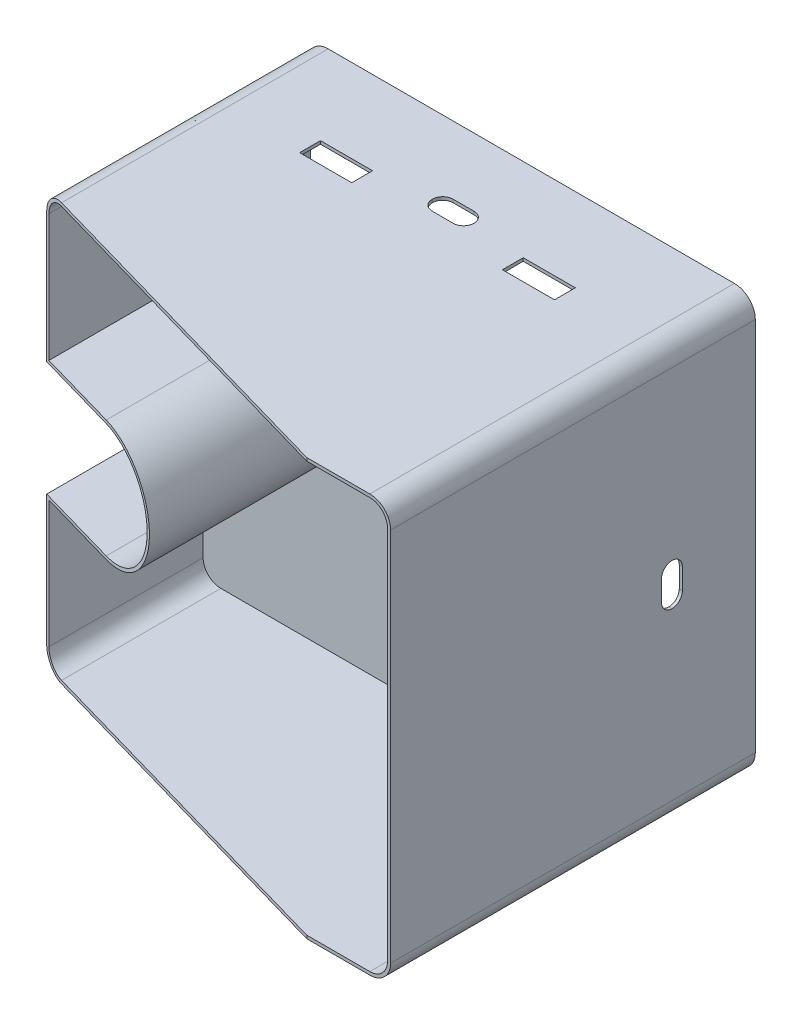
from build123d import *

# Parameters (mm, degrees)
EXTRUDE_1_DEPTH     = 250
SHELL_1_T           = -3
CUT_EXTRUDE_1_DEPTH = 547
EXTRUDE_START       = 100
EXTRUDE_3_DEPTH     = 100
SKETCH_6_W          = 50
SKETCH_6_H          = 20
CUT_EXTRUDE_3_DEPTH = 472
SKETCH_7_W          = 20
SKETCH_7_H          = 40
CUT_EXTRUDE_4_DEPTH = 472
FILLET_1_R          = 10
FILLET_2_R          = 10
CUT_EXTRUDE_5_DEPTH = 472


with BuildPart() as part:
    # 草图1 → 凸台-拉伸1 (new body)
    with BuildSketch(Plane.XY):
        with BuildLine():
            Line((-135, 55), (-215, 55))
            Line((-215, 55), (-215, 180))
            ThreePointArc((-215, 180), (-209.142135624, 194.142135624), (-195, 200))
            Line((-195, 200), (195, 200))
            ThreePointArc((195, 200), (209.142135624, 194.142135624), (215, 180))
            Line((215, 180), (215, -180))
            ThreePointArc((215, -180), (209.142135624, -194.142135624), (195, -200))
            Line((195, -200), (-195, -200))
            ThreePointArc((-195, -200), (-209.142135624, -194.142135624), (-215, -180))
            Line((-215, -180), (-215, -55))
            Line((-215, -55), (-135, -55))
            ThreePointArc((-135, -55), (-80, 0), (-135, 55))
        make_face()
    extrude(amount=EXTRUDE_1_DEPTH)

    # 抽壳1
    shell_1_openings = [part.faces().sort_by_distance(p)[0] for p in [
        (13.096091643, 0, 250),
    ]]
    offset(amount=SHELL_1_T, openings=shell_1_openings, kind=Kind.INTERSECTION)

    # 草图3 → 切除-拉伸1 (cut)
    with BuildSketch(Plane(origin=(0, 200, 0), x_dir=(1, 0, 0), z_dir=(0, 1, 0))):
        Polygon((134.47381547, -250), (-215.52618453, -150), (-215.52618453, -250), align=None)
    extrude(amount=-CUT_EXTRUDE_1_DEPTH, mode=Mode.SUBTRACT)

    # 草图4 → 凸台-拉伸3 (add)
    with BuildSketch(Plane(origin=(0, 0, 0), x_dir=(-1, 0, 0), z_dir=(0, 0, -1)).offset(EXTRUDE_START)):
        with BuildLine():
            Line((195, -200), (-195, -200))
            ThreePointArc((-195, -200), (-209.142135624, -194.142135624), (-215, -180))
            Line((-215, -180), (-215, 180))
            ThreePointArc((-215, 180), (-209.142135624, 194.142135624), (-195, 200))
            Line((-195, 200), (195, 200))
            ThreePointArc((195, 200), (209.142135624, 194.142135624), (215, 180))
            Line((215, 180), (215, -180))
            ThreePointArc((215, -180), (209.142135624, -194.142135624), (195, -200))
        make_face()
        with BuildLine():
            Line((195, -197), (-195, -197))
            ThreePointArc((-195, -197), (-207.02081528, -192.02081528), (-212, -180))
            Line((-212, -180), (-212, 180))
            ThreePointArc((-212, 180), (-207.02081528, 192.02081528), (-195, 197))
            Line((-195, 197), (195, 197))
            ThreePointArc((195, 197), (207.02081528, 192.02081528), (212, 180))
            Line((212, 180), (212, -180))
            ThreePointArc((212, -180), (207.02081528, -192.02081528), (195, -197))
        make_face(mode=Mode.SUBTRACT)
    extrude(amount=-EXTRUDE_3_DEPTH)

    # 草图6 → 切除-拉伸3 (cut)
    with BuildSketch(Plane(origin=(0, 200, 0), x_dir=(1, 0, 0), z_dir=(0, 1, 0))):
        with Locations((-97.377223929, 10)):
            Rectangle(SKETCH_6_W, SKETCH_6_H)
        with Locations((97.246218359, 10)):
            Rectangle(SKETCH_6_W, SKETCH_6_H)
    extrude(amount=-CUT_EXTRUDE_3_DEPTH, mode=Mode.SUBTRACT)

    # 草图7 → 切除-拉伸4 (cut)
    with BuildSketch(Plane.ZY.offset(215)):
        with Locations((-20, -0.350965312)):
            Rectangle(SKETCH_7_W, SKETCH_7_H)
    extrude(amount=-CUT_EXTRUDE_4_DEPTH, mode=Mode.SUBTRACT)

    # 圆角1
    fillet_1_edges = [part.edges().sort_by_distance(p)[0] for p in [
        (-213.5, -20.350965312, -30),
        (-213.5, -20.350965312, -10),
        (-213.5, 19.649034688, -10),
        (-213.5, 19.649034688, -30),
    ]]
    fillet(fillet_1_edges, radius=FILLET_1_R - 0.0001)  # a hair under: the kernel refuses the full size

    # 圆角2
    fillet_2_edges = [part.edges().sort_by_distance(p)[0] for p in [
        (213.5, -20.350965312, -30),
        (213.5, 19.649034688, -30),
        (213.5, 19.649034688, -10),
        (213.5, -20.350965312, -10),
    ]]
    fillet(fillet_2_edges, radius=FILLET_2_R - 0.0001)  # a hair under: the kernel refuses the full size

    # 草图8 → 切除-拉伸5 (cut)
    with BuildSketch(Plane(origin=(0, 200, 0), x_dir=(1, 0, 0), z_dir=(0, 1, 0))):
        with BuildLine():
            Line((10.1, 15), (-10.1, 15))
            ThreePointArc((-10.1, 15), (-17.100357134, 17.899642866), (-20, 24.9))
            Line((-20, 24.9), (-20, 25.1))
            ThreePointArc((-20, 25.1), (-17.100357134, 32.100357134), (-10.1, 35))
            Line((-10.1, 35), (10.1, 35))
            ThreePointArc((10.1, 35), (17.100357134, 32.100357134), (20, 25.1))
            Line((20, 25.1), (20, 24.9))
            ThreePointArc((20, 24.9), (17.100357134, 17.899642866), (10.1, 15))
        make_face()
    extrude(amount=-CUT_EXTRUDE_5_DEPTH, mode=Mode.SUBTRACT)


solid = part.part
